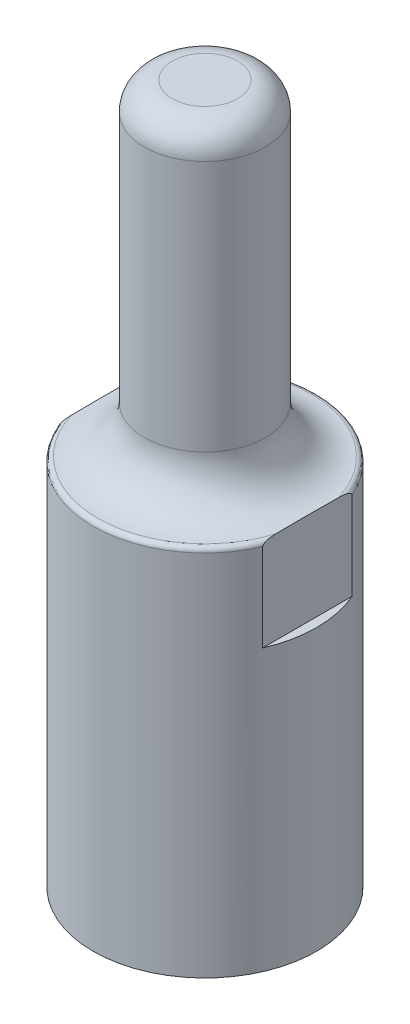
from build123d import *

# Parameters (mm, degrees)
SKETCH1_R               = 12
BOSS_EXTRUDE1_DEPTH     = 40
SKETCH2_R               = 6.5
BOSS_EXTRUDE2_DEPTH     = 35
FILLET1_R               = 3
FILLET2_R               = 5
FILLET3_R               = 0.5
CUT_EXTRUDE1_DEPTH      = 77.896033821
CUT_EXTRUDE1_DEPTH_BACK = 77.896033821
SKETCH3_W               = 1
SKETCH3_H               = 10
SKETCH4_R               = 4
CUT_EXTRUDE2_DEPTH      = 5


with BuildPart() as part:
    # Sketch1 → Boss-Extrude1 (new body)
    with BuildSketch(Plane(origin=(0, 0, 0), x_dir=(1, 0, 0), z_dir=(0, 1, 0))):
        with Locations(Location((0, 0, 0), (0, 0, 270))):
            Circle(SKETCH1_R)
    extrude(amount=BOSS_EXTRUDE1_DEPTH)

    # Sketch2 → Boss-Extrude2 (add)
    with BuildSketch(Plane(origin=(0, 40, 0), x_dir=(1, 0, 0), z_dir=(0, 1, 0))):
        with Locations(Location((0, 0, 0), (0, 0, 270))):
            Circle(SKETCH2_R)
    extrude(amount=BOSS_EXTRUDE2_DEPTH)

    # Fillet1
    fillet1_edges = [part.edges().sort_by_distance(p)[0] for p in [
        (0, 75, -6.5),
    ]]
    fillet(fillet1_edges, radius=FILLET1_R)

    # Fillet2
    fillet2_edges = [part.edges().sort_by_distance(p)[0] for p in [
        (0, 40, -6.5),
    ]]
    fillet(fillet2_edges, radius=FILLET2_R)

    # Fillet3
    fillet3_edges = [part.edges().sort_by_distance(p)[0] for p in [
        (0, 40, -12),
    ]]
    fillet(fillet3_edges, radius=FILLET3_R - 0.0001)  # a hair under: the kernel refuses the full size

    # Sketch3 → Cut-Extrude1 (cut, two sides: drawn at the far end of the back side and taken through both)
    with BuildSketch(Plane.XY.offset(-CUT_EXTRUDE1_DEPTH_BACK)):
        with Locations((-11.5, 35.09742525)):
            Rectangle(SKETCH3_W, SKETCH3_H)
        with Locations((11.5, 35.09742525)):
            Rectangle(SKETCH3_W, SKETCH3_H)
    extrude(amount=CUT_EXTRUDE1_DEPTH + CUT_EXTRUDE1_DEPTH_BACK, mode=Mode.SUBTRACT)

    # Sketch4 → Cut-Extrude2 (cut)
    with BuildSketch(Plane.XZ):
        with Locations(Location((0, 0, 0), (0, 0, 270))):
            Circle(SKETCH4_R)
    extrude(amount=-CUT_EXTRUDE2_DEPTH, mode=Mode.SUBTRACT)


solid = part.part
